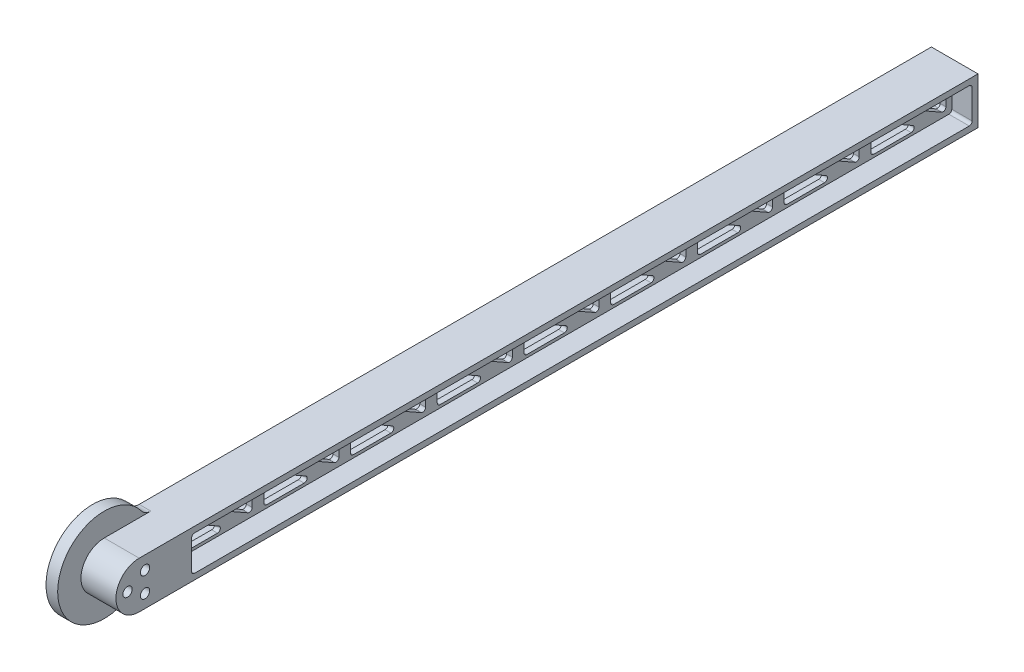
from build123d import *

# Parameters (mm, degrees)
SKETCH1_R           = 2.5527
BOSS_EXTRUDE1_DEPTH = 12.7
SKETCH3_R           = 25.4
BOSS_EXTRUDE2_DEPTH = 6.35
SKETCH4_R           = 2.5527
CUT_EXTRUDE1_DEPTH  = 459.301104624
FILLET1_R           = 6.35
CUT_EXTRUDE2_START  = -12.7
CUT_EXTRUDE2_DEPTH  = 25.4
SKETCH7_W           = 425.45
SKETCH7_H           = 19.05
CUT_EXTRUDE4_DEPTH  = 11.1125
FILLET3_R           = 1.5875
FILLET4_R           = 1.5875


# Read off the part's stored shape, not the designer's step: Cut-Extrude2
with BuildPart() as part:
    # Sketch1 → Boss-Extrude1 (new, symmetric)
    with BuildSketch(Plane(origin=(0, 0, 0), x_dir=(0, 0, -1), z_dir=(1, 0, 0))):
        with BuildLine():
            Line((0, 12.7), (457.2, 12.7))
            Line((457.2, 12.7), (457.2, -12.7))
            Line((457.2, -12.7), (0, -12.7))
            ThreePointArc((0, -12.7), (-12.7, 0), (0, 12.7))
        make_face()
        with Locations((3.175, 5.499261314)):
            Circle(SKETCH1_R, mode=Mode.SUBTRACT)
        with Locations((-6.35, 0)):
            Circle(SKETCH1_R, mode=Mode.SUBTRACT)
        with Locations((3.175, -5.499261314)):
            Circle(SKETCH1_R, mode=Mode.SUBTRACT)
    extrude(amount=BOSS_EXTRUDE1_DEPTH, both=True)

    # Sketch3 → Boss-Extrude2 (add)
    with BuildSketch(Plane.ZY.offset(12.7)):
        Circle(SKETCH3_R)
    extrude(amount=-BOSS_EXTRUDE2_DEPTH)

    # Sketch4 → Cut-Extrude1 (cut, through all)
    with BuildSketch(Plane(origin=(-6.35, 0, 0), x_dir=(0, 0, -1), z_dir=(1, 0, 0))):
        with Locations((3.175, 5.499261314)):
            Circle(SKETCH4_R)
        with Locations((3.175, -5.499261314)):
            Circle(SKETCH4_R)
        with Locations((-6.35, 0)):
            Circle(SKETCH4_R)
    extrude(amount=-CUT_EXTRUDE1_DEPTH, mode=Mode.SUBTRACT)

    # Fillet1
    fillet1_edges = [part.edges().sort_by_distance(p)[0] for p in [
        (-9.525, 12.7, -21.997045256),
        (-9.525, -12.7, -21.997045256),
    ]]
    fillet(fillet1_edges, radius=FILLET1_R)

    # Cut-Extrude2 outline → Cut-Extrude2 (cut)
    with BuildSketch(Plane.YZ.offset(CUT_EXTRUDE2_START)):
        Polygon((7.9375, -31.75), (-7.9375, -31.75), (-7.9375, -59.785120896), align=None)
        Polygon((7.9375, -79.022222222), (-7.9375, -79.022222222), (-7.9375, -107.057343118), align=None)
        Polygon((7.9375, -126.294444444), (-7.9375, -126.294444444), (-7.9375, -154.329565341), align=None)
        Polygon((7.9375, -173.566666667), (-7.9375, -173.566666667), (-7.9375, -201.601787563), align=None)
        Polygon((7.9375, -220.838888889), (-7.9375, -220.838888889), (-7.9375, -248.874009785), align=None)
        Polygon((7.9375, -268.111111111), (-7.9375, -268.111111111), (-7.9375, -296.146232007), align=None)
        Polygon((7.9375, -315.383333333), (-7.9375, -315.383333333), (-7.9375, -343.41845423), align=None)
        Polygon((7.9375, -362.655555556), (-7.9375, -362.655555556), (-7.9375, -390.690676452), align=None)
        Polygon((7.9375, -409.927777778), (-7.9375, -409.927777778), (-7.9375, -437.962898674), align=None)
        Polygon((7.9375, -44.637101326), (-7.9375, -72.672222222), (7.9375, -72.672222222), align=None)
        Polygon((-7.9375, -119.944444444), (7.9375, -119.944444444), (7.9375, -91.909323548), align=None)
        Polygon((-7.9375, -214.488888889), (7.9375, -214.488888889), (7.9375, -186.453767993), align=None)
        Polygon((-7.9375, -309.033333333), (7.9375, -309.033333333), (7.9375, -280.998212437), align=None)
        Polygon((-7.9375, -450.85), (7.9375, -450.85), (7.9375, -422.814879104), align=None)
        Polygon((-7.9375, -167.216666667), (7.9375, -167.216666667), (7.9375, -139.18154577), align=None)
        Polygon((-7.9375, -261.761111111), (7.9375, -261.761111111), (7.9375, -233.725990215), align=None)
        Polygon((-7.9375, -356.305555556), (7.9375, -356.305555556), (7.9375, -328.270434659), align=None)
        Polygon((-7.9375, -403.577777778), (7.9375, -403.577777778), (7.9375, -375.542656882), align=None)
    extrude(amount=CUT_EXTRUDE2_DEPTH, mode=Mode.SUBTRACT)

    # Sketch7 → Cut-Extrude4 (cut)
    with BuildSketch(Plane.ZY.offset(12.7)):
        with Locations((-241.3, 0)):
            Rectangle(SKETCH7_W, SKETCH7_H)
    cut_extrude4 = extrude(amount=-CUT_EXTRUDE4_DEPTH, mode=Mode.SUBTRACT)

    # Fillet3
    fillet3_edges = [part.edges().sort_by_distance(p)[0] for p in [
        (5.55625, 7.9375, -375.542656882),
        (5.55625, 7.9375, -403.577777778),
        (5.55625, -7.9375, -403.577777778),
        (5.55625, 7.9375, -328.270434659),
        (5.55625, 7.9375, -356.305555556),
        (5.55625, -7.9375, -356.305555556),
        (5.55625, 7.9375, -233.725990215),
        (5.55625, 7.9375, -261.761111111),
        (5.55625, -7.9375, -261.761111111),
        (5.55625, 7.9375, -139.18154577),
        (5.55625, 7.9375, -167.216666667),
        (5.55625, -7.9375, -167.216666667),
        (5.55625, 7.9375, -422.814879104),
        (5.55625, 7.9375, -450.85),
        (5.55625, -7.9375, -450.85),
        (5.55625, 7.9375, -409.927777778),
        (5.55625, -7.9375, -437.962898674),
        (5.55625, -7.9375, -409.927777778),
        (5.55625, 7.9375, -362.655555556),
        (5.55625, -7.9375, -390.690676452),
        (5.55625, -7.9375, -362.655555556),
        (5.55625, 7.9375, -315.383333333),
        (5.55625, -7.9375, -343.41845423),
        (5.55625, -7.9375, -315.383333333),
        (5.55625, 7.9375, -280.998212437),
        (5.55625, 7.9375, -309.033333333),
        (5.55625, -7.9375, -309.033333333),
        (5.55625, 7.9375, -268.111111111),
        (5.55625, -7.9375, -296.146232007),
        (5.55625, -7.9375, -268.111111111),
        (5.55625, 7.9375, -220.838888889),
        (5.55625, -7.9375, -248.874009785),
        (5.55625, -7.9375, -220.838888889),
        (5.55625, 7.9375, -186.453767993),
        (5.55625, 7.9375, -214.488888889),
        (5.55625, -7.9375, -214.488888889),
        (5.55625, 7.9375, -173.566666667),
        (5.55625, -7.9375, -201.601787563),
        (5.55625, -7.9375, -173.566666667),
        (5.55625, 7.9375, -126.294444444),
        (5.55625, -7.9375, -154.329565341),
        (5.55625, -7.9375, -126.294444444),
        (5.55625, 7.9375, -91.909323548),
        (5.55625, 7.9375, -119.944444444),
        (5.55625, -7.9375, -119.944444444),
        (5.55625, 7.9375, -79.022222222),
        (5.55625, -7.9375, -107.057343118),
        (5.55625, -7.9375, -79.022222222),
        (5.55625, 7.9375, -44.637101326),
        (5.55625, 7.9375, -72.672222222),
        (5.55625, -7.9375, -72.672222222),
        (5.55625, 7.9375, -31.75),
        (5.55625, -7.9375, -59.785120896),
        (5.55625, -7.9375, -31.75),
    ]]
    fillet(fillet3_edges, radius=FILLET3_R)

    # Mirror1: Cut-Extrude4 across plane
    add(cut_extrude4.mirror(Plane(origin=(0, 0, 0), x_dir=(0, 0, 1), z_dir=(1, 0, 0))), mode=Mode.SUBTRACT)

    # Fillet4
    fillet4_edges = [part.edges().sort_by_distance(p)[0] for p in [
        (-7.14375, -9.525, -28.575),
        (-7.14375, -9.525, -454.025),
        (-7.14375, 9.525, -454.025),
        (-7.14375, 9.525, -28.575),
        (7.14375, -9.525, -454.025),
        (7.14375, -9.525, -28.575),
        (7.14375, 9.525, -28.575),
        (7.14375, 9.525, -454.025),
    ]]
    fillet(fillet4_edges, radius=FILLET4_R)


solid = part.part
